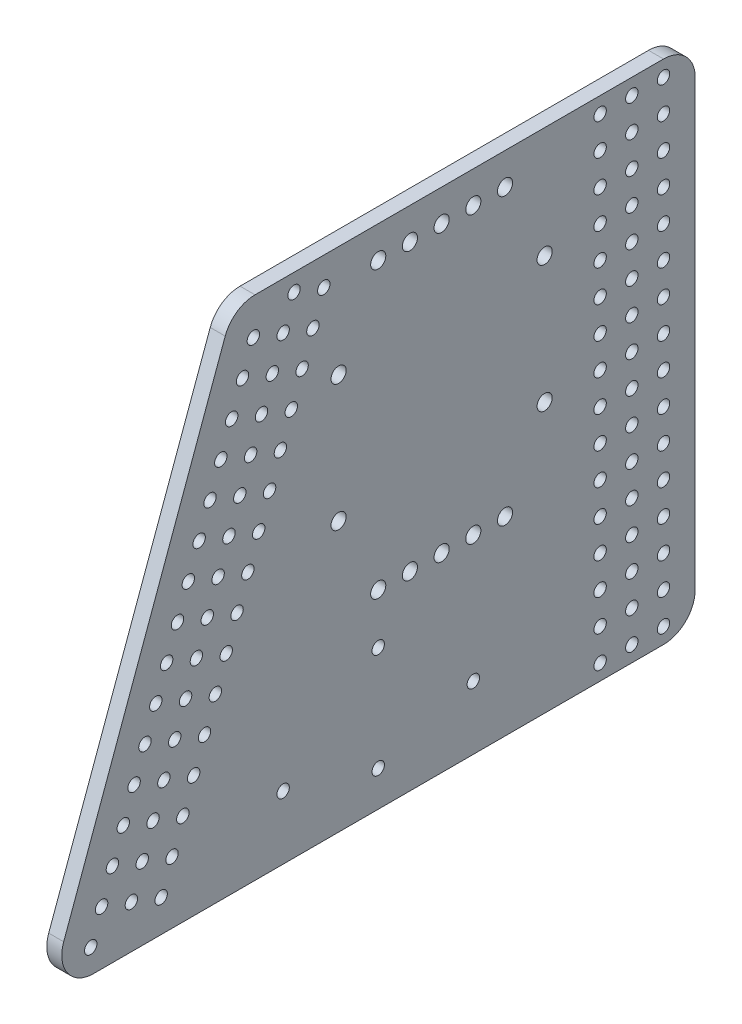
from build123d import *

# Parameters (mm, degrees)
SKETCH1_R           = 2.4892
BOSS_EXTRUDE1_DEPTH = 6
FILLET1_R           = 12.7
SKETCH4_R           = 3.030873179
CUT_EXTRUDE1_DEPTH  = 330.429722485
SKETCH5_R           = 2.4892
CUT_EXTRUDE2_DEPTH  = 330.429722485


with BuildPart() as part:
    # Sketch1 → Boss-Extrude1 (new body)
    with BuildSketch(Plane(origin=(17.71343226, 0, 0), x_dir=(0, 0, -1), z_dir=(1, 0, 0))):
        Polygon((73.958751603, 203.2), (0, 0), (259.225195644, 0), (259.225195644, 203.2), align=None)
        with Locations((17.043593575, 9.694572611)):
            Circle(SKETCH1_R, mode=Mode.SUBTRACT)
        with Locations((21.387249395, 21.628668895)):
            Circle(SKETCH1_R, mode=Mode.SUBTRACT)
        with Locations((33.321345679, 17.285013075)):
            Circle(SKETCH1_R, mode=Mode.SUBTRACT)
        with Locations((45.255441963, 12.941357254)):
            Circle(SKETCH1_R, mode=Mode.SUBTRACT)
        with Locations((49.599097783, 24.875453538)):
            Circle(SKETCH1_R, mode=Mode.SUBTRACT)
        with Locations((25.730905215, 33.562765179)):
            Circle(SKETCH1_R, mode=Mode.SUBTRACT)
        with Locations((30.074561035, 45.496861463)):
            Circle(SKETCH1_R, mode=Mode.SUBTRACT)
        with Locations((37.665001499, 29.219109359)):
            Circle(SKETCH1_R, mode=Mode.SUBTRACT)
        with Locations((53.942753603, 36.809549822)):
            Circle(SKETCH1_R, mode=Mode.SUBTRACT)
        with Locations((42.008657319, 41.153205642)):
            Circle(SKETCH1_R, mode=Mode.SUBTRACT)
        with Locations((58.286409424, 48.743646106)):
            Circle(SKETCH1_R, mode=Mode.SUBTRACT)
        with Locations((46.35231314, 53.087301926)):
            Circle(SKETCH1_R, mode=Mode.SUBTRACT)
        with Locations((34.418216856, 57.430957747)):
            Circle(SKETCH1_R, mode=Mode.SUBTRACT)
        with Locations((62.630065244, 60.67774239)):
            Circle(SKETCH1_R, mode=Mode.SUBTRACT)
        with Locations((38.761872676, 69.365054031)):
            Circle(SKETCH1_R, mode=Mode.SUBTRACT)
        with Locations((50.69596896, 65.02139821)):
            Circle(SKETCH1_R, mode=Mode.SUBTRACT)
        with Locations((43.105528496, 81.299150315)):
            Circle(SKETCH1_R, mode=Mode.SUBTRACT)
        with Locations((55.03962478, 76.955494494)):
            Circle(SKETCH1_R, mode=Mode.SUBTRACT)
        with Locations((59.3832806, 88.889590778)):
            Circle(SKETCH1_R, mode=Mode.SUBTRACT)
        with Locations((47.449184316, 93.233246599)):
            Circle(SKETCH1_R, mode=Mode.SUBTRACT)
        with Locations((63.726936421, 100.823687062)):
            Circle(SKETCH1_R, mode=Mode.SUBTRACT)
        with Locations((66.973721064, 72.611838674)):
            Circle(SKETCH1_R, mode=Mode.SUBTRACT)
        with Locations((71.317376884, 84.545934958)):
            Circle(SKETCH1_R, mode=Mode.SUBTRACT)
        with Locations((75.661032705, 96.480031242)):
            Circle(SKETCH1_R, mode=Mode.SUBTRACT)
        with Locations((221.125195644, 6.35)):
            Circle(SKETCH1_R, mode=Mode.SUBTRACT)
        with Locations((221.125195644, 19.05)):
            Circle(SKETCH1_R, mode=Mode.SUBTRACT)
        with Locations((233.825195644, 6.35)):
            Circle(SKETCH1_R, mode=Mode.SUBTRACT)
        with Locations((246.525195644, 6.35)):
            Circle(SKETCH1_R, mode=Mode.SUBTRACT)
        with Locations((233.825195644, 19.05)):
            Circle(SKETCH1_R, mode=Mode.SUBTRACT)
        with Locations((246.525195644, 19.05)):
            Circle(SKETCH1_R, mode=Mode.SUBTRACT)
        with Locations((221.125195644, 31.75)):
            Circle(SKETCH1_R, mode=Mode.SUBTRACT)
        with Locations((221.125195644, 44.45)):
            Circle(SKETCH1_R, mode=Mode.SUBTRACT)
        with Locations((233.825195644, 31.75)):
            Circle(SKETCH1_R, mode=Mode.SUBTRACT)
        with Locations((246.525195644, 31.75)):
            Circle(SKETCH1_R, mode=Mode.SUBTRACT)
        with Locations((233.825195644, 44.45)):
            Circle(SKETCH1_R, mode=Mode.SUBTRACT)
        with Locations((246.525195644, 44.45)):
            Circle(SKETCH1_R, mode=Mode.SUBTRACT)
        with Locations((221.125195644, 57.15)):
            Circle(SKETCH1_R, mode=Mode.SUBTRACT)
        with Locations((221.125195644, 69.85)):
            Circle(SKETCH1_R, mode=Mode.SUBTRACT)
        with Locations((233.825195644, 57.15)):
            Circle(SKETCH1_R, mode=Mode.SUBTRACT)
        with Locations((246.525195644, 57.15)):
            Circle(SKETCH1_R, mode=Mode.SUBTRACT)
        with Locations((233.825195644, 69.85)):
            Circle(SKETCH1_R, mode=Mode.SUBTRACT)
        with Locations((246.525195644, 69.85)):
            Circle(SKETCH1_R, mode=Mode.SUBTRACT)
        with Locations((221.125195644, 82.55)):
            Circle(SKETCH1_R, mode=Mode.SUBTRACT)
        with Locations((221.125195644, 95.25)):
            Circle(SKETCH1_R, mode=Mode.SUBTRACT)
        with Locations((233.825195644, 82.55)):
            Circle(SKETCH1_R, mode=Mode.SUBTRACT)
        with Locations((246.525195644, 82.55)):
            Circle(SKETCH1_R, mode=Mode.SUBTRACT)
        with Locations((233.825195644, 95.25)):
            Circle(SKETCH1_R, mode=Mode.SUBTRACT)
        with Locations((246.525195644, 95.25)):
            Circle(SKETCH1_R, mode=Mode.SUBTRACT)
        with Locations((51.792840137, 105.167342883)):
            Circle(SKETCH1_R, mode=Mode.SUBTRACT)
        with Locations((56.136495957, 117.101439167)):
            Circle(SKETCH1_R, mode=Mode.SUBTRACT)
        with Locations((60.480151777, 129.035535451)):
            Circle(SKETCH1_R, mode=Mode.SUBTRACT)
        with Locations((68.070592241, 112.757783346)):
            Circle(SKETCH1_R, mode=Mode.SUBTRACT)
        with Locations((80.004688525, 108.414127526)):
            Circle(SKETCH1_R, mode=Mode.SUBTRACT)
        with Locations((72.414248061, 124.69187963)):
            Circle(SKETCH1_R, mode=Mode.SUBTRACT)
        with Locations((84.348344345, 120.34822381)):
            Circle(SKETCH1_R, mode=Mode.SUBTRACT)
        with Locations((76.757903881, 136.625975914)):
            Circle(SKETCH1_R, mode=Mode.SUBTRACT)
        with Locations((88.692000165, 132.282320094)):
            Circle(SKETCH1_R, mode=Mode.SUBTRACT)
        with Locations((64.823807597, 140.969631735)):
            Circle(SKETCH1_R, mode=Mode.SUBTRACT)
        with Locations((93.035655986, 144.216416378)):
            Circle(SKETCH1_R, mode=Mode.SUBTRACT)
        with Locations((81.101559702, 148.560072198)):
            Circle(SKETCH1_R, mode=Mode.SUBTRACT)
        with Locations((69.167463418, 152.903728019)):
            Circle(SKETCH1_R, mode=Mode.SUBTRACT)
        with Locations((73.511119238, 164.837824303)):
            Circle(SKETCH1_R, mode=Mode.SUBTRACT)
        with Locations((85.445215522, 160.494168482)):
            Circle(SKETCH1_R, mode=Mode.SUBTRACT)
        with Locations((77.854775058, 176.771920587)):
            Circle(SKETCH1_R, mode=Mode.SUBTRACT)
        with Locations((89.788871342, 172.428264766)):
            Circle(SKETCH1_R, mode=Mode.SUBTRACT)
        with Locations((97.379311806, 156.150512662)):
            Circle(SKETCH1_R, mode=Mode.SUBTRACT)
        with Locations((101.722967626, 168.084608946)):
            Circle(SKETCH1_R, mode=Mode.SUBTRACT)
        with Locations((82.198430878, 188.70601687)):
            Circle(SKETCH1_R, mode=Mode.SUBTRACT)
        with Locations((94.132527162, 184.36236105)):
            Circle(SKETCH1_R, mode=Mode.SUBTRACT)
        with Locations((106.066623446, 180.01870523)):
            Circle(SKETCH1_R, mode=Mode.SUBTRACT)
        with Locations((98.476182982, 196.296457334)):
            Circle(SKETCH1_R, mode=Mode.SUBTRACT)
        with Locations((110.410279266, 191.952801514)):
            Circle(SKETCH1_R, mode=Mode.SUBTRACT)
        with Locations((221.125195644, 107.95)):
            Circle(SKETCH1_R, mode=Mode.SUBTRACT)
        with Locations((221.125195644, 120.65)):
            Circle(SKETCH1_R, mode=Mode.SUBTRACT)
        with Locations((233.825195644, 107.95)):
            Circle(SKETCH1_R, mode=Mode.SUBTRACT)
        with Locations((246.525195644, 107.95)):
            Circle(SKETCH1_R, mode=Mode.SUBTRACT)
        with Locations((233.825195644, 120.65)):
            Circle(SKETCH1_R, mode=Mode.SUBTRACT)
        with Locations((246.525195644, 120.65)):
            Circle(SKETCH1_R, mode=Mode.SUBTRACT)
        with Locations((221.125195644, 133.35)):
            Circle(SKETCH1_R, mode=Mode.SUBTRACT)
        with Locations((221.125195644, 146.05)):
            Circle(SKETCH1_R, mode=Mode.SUBTRACT)
        with Locations((233.825195644, 133.35)):
            Circle(SKETCH1_R, mode=Mode.SUBTRACT)
        with Locations((246.525195644, 133.35)):
            Circle(SKETCH1_R, mode=Mode.SUBTRACT)
        with Locations((233.825195644, 146.05)):
            Circle(SKETCH1_R, mode=Mode.SUBTRACT)
        with Locations((246.525195644, 146.05)):
            Circle(SKETCH1_R, mode=Mode.SUBTRACT)
        with Locations((221.125195644, 158.75)):
            Circle(SKETCH1_R, mode=Mode.SUBTRACT)
        with Locations((221.125195644, 171.45)):
            Circle(SKETCH1_R, mode=Mode.SUBTRACT)
        with Locations((233.825195644, 158.75)):
            Circle(SKETCH1_R, mode=Mode.SUBTRACT)
        with Locations((246.525195644, 158.75)):
            Circle(SKETCH1_R, mode=Mode.SUBTRACT)
        with Locations((233.825195644, 171.45)):
            Circle(SKETCH1_R, mode=Mode.SUBTRACT)
        with Locations((246.525195644, 171.45)):
            Circle(SKETCH1_R, mode=Mode.SUBTRACT)
        with Locations((221.125195644, 184.15)):
            Circle(SKETCH1_R, mode=Mode.SUBTRACT)
        with Locations((221.125195644, 196.85)):
            Circle(SKETCH1_R, mode=Mode.SUBTRACT)
        with Locations((233.825195644, 184.15)):
            Circle(SKETCH1_R, mode=Mode.SUBTRACT)
        with Locations((246.525195644, 184.15)):
            Circle(SKETCH1_R, mode=Mode.SUBTRACT)
        with Locations((233.825195644, 196.85)):
            Circle(SKETCH1_R, mode=Mode.SUBTRACT)
        with Locations((246.525195644, 196.85)):
            Circle(SKETCH1_R, mode=Mode.SUBTRACT)
    extrude(amount=BOSS_EXTRUDE1_DEPTH)

    # Fillet1
    fillet1_edges = [part.edges().sort_by_distance(p)[0] for p in [
        (20.71343226, 203.2, -259.225195644),
        (20.71343226, 0, -259.225195644),
        (20.71343226, 203.2, -73.958751603),
        (20.71343226, 0, 0),
    ]]
    fillet(fillet1_edges, radius=FILLET1_R)

    # Sketch4 → Cut-Extrude1 (cut, through all)
    with BuildSketch(Plane.ZY.offset(-17.71343226)):
        with Locations((-183.025195644, 190.5)):
            Circle(SKETCH4_R)
        with Locations((-170.325195644, 190.5)):
            Circle(SKETCH4_R)
        with Locations((-157.625195644, 190.5)):
            Circle(SKETCH4_R)
        with Locations((-144.925195644, 190.5)):
            Circle(SKETCH4_R)
        with Locations((-183.025195644, 76.2)):
            Circle(SKETCH4_R)
        with Locations((-170.325195644, 76.2)):
            Circle(SKETCH4_R)
        with Locations((-157.625195644, 76.2)):
            Circle(SKETCH4_R)
        with Locations((-144.925195644, 76.2)):
            Circle(SKETCH4_R)
        with Locations((-132.225195644, 190.5)):
            Circle(SKETCH4_R)
        with Locations((-132.225195644, 76.2)):
            Circle(SKETCH4_R)
        with Locations((-198.900195644, 158.75)):
            Circle(SKETCH4_R)
        with Locations((-198.900195644, 107.95)):
            Circle(SKETCH4_R)
        with Locations((-116.350195644, 158.75)):
            Circle(SKETCH4_R)
        with Locations((-116.350195644, 107.95)):
            Circle(SKETCH4_R)
    extrude(amount=-CUT_EXTRUDE1_DEPTH, mode=Mode.SUBTRACT)

    # Sketch5 → Cut-Extrude2 (cut, through all)
    with BuildSketch(Plane.ZY.offset(-17.71343226)):
        with Locations((-170.325195644, 25.4)):
            Circle(SKETCH5_R)
        with Locations((-94.125195644, 25.4)):
            Circle(SKETCH5_R)
        with Locations((-132.225195644, 56.134)):
            Circle(SKETCH5_R)
        with Locations((-132.225195644, 14.224)):
            Circle(SKETCH5_R)
    extrude(amount=-CUT_EXTRUDE2_DEPTH, mode=Mode.SUBTRACT)


solid = part.part
